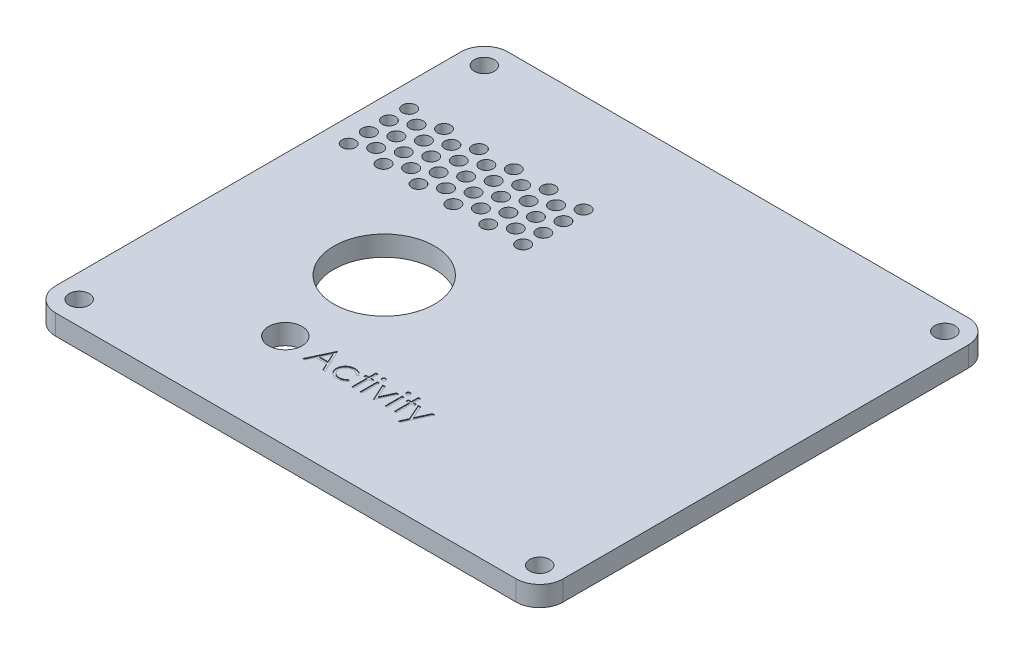
from build123d import *

# Parameters (mm, degrees)
ESQUISSE1_W                         = 75.58
ESQUISSE1_H                         = 67.34
ESQUISSE1_R                         = 1.5
BOSS_EXTRU_1_DEPTH                  = 3
ESQUISSE3_R                         = 2.5
ESQUISSE3_R_2                       = 7.5
ENL_V_MAT_EXTRU_1_DEPTH             = 52.83023249
ESQUISSE5_R                         = 1
ENL_V_MAT_EXTRU_3_DEPTH             = 52.83023249
R_P_TITION_DANS_UNE_ZONE2_OUTLINE_R = 1
R_P_TITION_DANS_UNE_ZONE2_DEPTH     = 3
CONG_1_R                            = 3.5
ESQUISSE6_W                         = 0.314102564
ESQUISSE6_H                         = 2.557692308
ESQUISSE6_W_2                       = 0.314102565
ENL_V_MAT_EXTRU_4_DEPTH             = 0.1


# Read off the part's stored shape, not the designer's step: Répétition dans une zone2
with BuildPart() as part:
    # Esquisse1 → Boss.-Extru.1 (new body)
    with BuildSketch(Plane(origin=(0, 0, 0), x_dir=(1, 0, 0), z_dir=(0, 1, 0))):
        with Locations((1.5, 0)):
            Rectangle(ESQUISSE1_W, ESQUISSE1_H)
        with Locations(Location((-32.79, 30.17, 0), (0, 0, 270))):
            Circle(ESQUISSE1_R, mode=Mode.SUBTRACT)
        with Locations(Location((35.79, 30.17, 0), (0, 0, 270))):
            Circle(ESQUISSE1_R, mode=Mode.SUBTRACT)
        with Locations(Location((35.79, -30.17, 0), (0, 0, 270))):
            Circle(ESQUISSE1_R, mode=Mode.SUBTRACT)
        with Locations(Location((-32.79, -30.17, 0), (0, 0, 270))):
            Circle(ESQUISSE1_R, mode=Mode.SUBTRACT)
    extrude(amount=BOSS_EXTRU_1_DEPTH)

    # Esquisse3 → Enlèv. mat.-Extru.1 (cut, through all)
    with BuildSketch(Plane(origin=(0, 3, 0), x_dir=(1, 0, 0), z_dir=(0, 1, 0))):
        with Locations(Location((-12.7, -19.558, 0), (0, 0, 270))):
            Circle(ESQUISSE3_R)
        with Locations(Location((-13.208, -4.318, 0), (0, 0, 270))):
            Circle(ESQUISSE3_R_2)
    extrude(amount=-ENL_V_MAT_EXTRU_1_DEPTH, mode=Mode.SUBTRACT)

    # Esquisse5 → Enlèv. mat.-Extru.3 (cut, through all)
    with BuildSketch(Plane(origin=(0, 3, 0), x_dir=(1, 0, 0), z_dir=(0, 1, 0))):
        with Locations(Location((-19.81, 14.48, 0), (0, 0, 270))):
            Circle(ESQUISSE5_R)
    extrude(amount=-ENL_V_MAT_EXTRU_3_DEPTH, mode=Mode.SUBTRACT)

    # Répétition dans une zone2 outline → Répétition dans une zone2 (cut)
    with BuildSketch(Plane(origin=(0, 0, 0), x_dir=(1, 0, 0), z_dir=(0, 1, 0))):
        with Locations((-6.819618943, 18.98)):
            Circle(R_P_TITION_DANS_UNE_ZONE2_OUTLINE_R)
        with Locations((-27.604228634, 9.98)):
            Circle(R_P_TITION_DANS_UNE_ZONE2_OUTLINE_R)
        with Locations((-30.202304845, 11.48)):
            Circle(R_P_TITION_DANS_UNE_ZONE2_OUTLINE_R)
        with Locations((-32.800381057, 12.98)):
            Circle(R_P_TITION_DANS_UNE_ZONE2_OUTLINE_R)
        with Locations((-22.408076211, 9.98)):
            Circle(R_P_TITION_DANS_UNE_ZONE2_OUTLINE_R)
        with Locations((-32.800381057, 9.98)):
            Circle(R_P_TITION_DANS_UNE_ZONE2_OUTLINE_R)
        with Locations((-22.408076211, 18.98)):
            Circle(R_P_TITION_DANS_UNE_ZONE2_OUTLINE_R)
        with Locations((-19.81, 17.48)):
            Circle(R_P_TITION_DANS_UNE_ZONE2_OUTLINE_R)
        with Locations((-17.211923789, 15.98)):
            Circle(R_P_TITION_DANS_UNE_ZONE2_OUTLINE_R)
        with Locations((-14.613847577, 14.48)):
            Circle(R_P_TITION_DANS_UNE_ZONE2_OUTLINE_R)
        with Locations((-27.604228634, 18.98)):
            Circle(R_P_TITION_DANS_UNE_ZONE2_OUTLINE_R)
        with Locations((-6.819618943, 9.98)):
            Circle(R_P_TITION_DANS_UNE_ZONE2_OUTLINE_R)
        with Locations((-9.417695155, 11.48)):
            Circle(R_P_TITION_DANS_UNE_ZONE2_OUTLINE_R)
        with Locations((-12.015771366, 12.98)):
            Circle(R_P_TITION_DANS_UNE_ZONE2_OUTLINE_R)
        with Locations((-17.211923789, 18.98)):
            Circle(R_P_TITION_DANS_UNE_ZONE2_OUTLINE_R)
        with Locations((-6.819618943, 15.98)):
            Circle(R_P_TITION_DANS_UNE_ZONE2_OUTLINE_R)
        with Locations((-9.417695155, 17.48)):
            Circle(R_P_TITION_DANS_UNE_ZONE2_OUTLINE_R)
        with Locations((-12.015771366, 18.98)):
            Circle(R_P_TITION_DANS_UNE_ZONE2_OUTLINE_R)
        with Locations((-14.613847577, 17.48)):
            Circle(R_P_TITION_DANS_UNE_ZONE2_OUTLINE_R)
        with Locations((-12.015771366, 15.98)):
            Circle(R_P_TITION_DANS_UNE_ZONE2_OUTLINE_R)
        with Locations((-9.417695155, 14.48)):
            Circle(R_P_TITION_DANS_UNE_ZONE2_OUTLINE_R)
        with Locations((-6.819618943, 12.98)):
            Circle(R_P_TITION_DANS_UNE_ZONE2_OUTLINE_R)
        with Locations((-25.006152423, 14.48)):
            Circle(R_P_TITION_DANS_UNE_ZONE2_OUTLINE_R)
        with Locations((-22.408076211, 12.98)):
            Circle(R_P_TITION_DANS_UNE_ZONE2_OUTLINE_R)
        with Locations((-19.81, 11.48)):
            Circle(R_P_TITION_DANS_UNE_ZONE2_OUTLINE_R)
        with Locations((-17.211923789, 9.98)):
            Circle(R_P_TITION_DANS_UNE_ZONE2_OUTLINE_R)
        with Locations((-32.800381057, 15.98)):
            Circle(R_P_TITION_DANS_UNE_ZONE2_OUTLINE_R)
        with Locations((-30.202304845, 14.48)):
            Circle(R_P_TITION_DANS_UNE_ZONE2_OUTLINE_R)
        with Locations((-27.604228634, 12.98)):
            Circle(R_P_TITION_DANS_UNE_ZONE2_OUTLINE_R)
        with Locations((-25.006152423, 11.48)):
            Circle(R_P_TITION_DANS_UNE_ZONE2_OUTLINE_R)
        with Locations((-25.006152423, 17.48)):
            Circle(R_P_TITION_DANS_UNE_ZONE2_OUTLINE_R)
        with Locations((-22.408076211, 15.98)):
            Circle(R_P_TITION_DANS_UNE_ZONE2_OUTLINE_R)
        with Locations((-17.211923789, 12.98)):
            Circle(R_P_TITION_DANS_UNE_ZONE2_OUTLINE_R)
        with Locations((-14.613847577, 11.48)):
            Circle(R_P_TITION_DANS_UNE_ZONE2_OUTLINE_R)
        with Locations((-27.604228634, 15.98)):
            Circle(R_P_TITION_DANS_UNE_ZONE2_OUTLINE_R)
        with Locations((-30.202304845, 17.48)):
            Circle(R_P_TITION_DANS_UNE_ZONE2_OUTLINE_R)
        with Locations((-32.800381057, 18.98)):
            Circle(R_P_TITION_DANS_UNE_ZONE2_OUTLINE_R)
        with Locations((-12.015771366, 9.98)):
            Circle(R_P_TITION_DANS_UNE_ZONE2_OUTLINE_R)
    extrude(amount=R_P_TITION_DANS_UNE_ZONE2_DEPTH, mode=Mode.SUBTRACT)

    # Congé1
    cong_1_edges = [part.edges().sort_by_distance(p)[0] for p in [
        (39.29, 1.5, 33.67),
        (-36.29, 1.5, 33.67),
        (-36.29, 1.5, -33.67),
        (39.29, 1.5, -33.67),
    ]]
    fillet(cong_1_edges, radius=CONG_1_R)

    # Esquisse6 → Enlèv. mat.-Extru.4 (cut)
    # profile 1 of 10: a face of its own
    with BuildSketch(Plane(origin=(0, 3, 0), x_dir=(1, 0, 0), z_dir=(0, 1, 0))):
        Polygon((-6.815384615, -17.658), (-5.2, -21.158), (-5.541446314, -21.158), (-6.058874199, -20.036205128), (-7.645512821, -20.036205128), (-8.177664263, -21.158), (-8.520512821, -21.158), (-6.86025641, -17.658), align=None)
        Polygon((-6.841326122, -18.340191506), (-7.475140224, -19.677230769), (-6.224338942, -19.677230769), align=None, mode=Mode.SUBTRACT)
    # profile 2 of 10: a face of its own
    with BuildSketch(Plane(origin=(0, 3, 0), x_dir=(1, 0, 0), z_dir=(0, 1, 0))):
        with BuildLine():
            Line((-2.148717949, -19.154895032), (-2.411638622, -19.31825641))
            add(Edge.make_bspline(
                [(-2.411638622, -19.31825641), (-2.440468487, -19.282428016), (-2.497215182, -19.211905906), (-2.595754419, -19.120895973), (-2.700765833, -19.042728931), (-2.814043881, -18.97902518), (-2.935429681, -18.92980373), (-3.064444532, -18.894973524), (-3.201070037, -18.873269281), (-3.294735236, -18.870802445), (-3.342728365, -18.869538462)],
                knots=[0, 0, 0, 0, 1.026593902, 2.0206758, 2.988051866, 3.946915611, 4.916868779, 5.907761954, 6.927957743, 8, 8, 8, 8], degree=3))
            add(Edge.make_bspline(
                [(-3.342728365, -18.869538462), (-3.381087322, -18.870595304), (-3.456634245, -18.872676726), (-3.567540398, -18.885687219), (-3.673182752, -18.909329227), (-3.77422346, -18.940480184), (-3.869943879, -18.982230474), (-3.960594797, -19.03304023), (-4.046980287, -19.09209027), (-4.126597029, -19.160500816), (-4.199426036, -19.234899484), (-4.26252495, -19.314653179), (-4.317461883, -19.39737307), (-4.360567839, -19.485124812), (-4.39584301, -19.575900866), (-4.41904973, -19.671414721), (-4.434514425, -19.770442729), (-4.436283754, -19.837961069), (-4.437179487, -19.872142628)],
                knots=[0, 0, 0, 0, 1.112346261, 2.190735716, 3.231507886, 4.247384806, 5.251966152, 6.253067467, 7.256802811, 8.280671706, 9.291813951, 10.270744147, 11.225547591, 12.165006084, 13.100104208, 14.043489273, 15.009504848, 16, 16, 16, 16], degree=3))
            add(Edge.make_bspline(
                [(-4.437179487, -19.872142628), (-4.435400235, -19.916911839), (-4.431865704, -20.005847035), (-4.404164245, -20.137125137), (-4.358819837, -20.264048827), (-4.296761987, -20.385716964), (-4.218284852, -20.49831112), (-4.126112289, -20.599294574), (-4.020193206, -20.686710602), (-3.901460875, -20.759183127), (-3.772703132, -20.817444495), (-3.635313027, -20.858951828), (-3.490413246, -20.8840042), (-3.391206499, -20.887160143), (-3.340625, -20.888769231)],
                knots=[0, 0, 0, 0, 0.966302908, 1.919585723, 2.883856336, 3.870342332, 4.860282998, 5.839159637, 6.814385684, 7.815993281, 8.834850808, 9.858348828, 10.908058873, 12, 12, 12, 12], degree=3))
            add(Edge.make_bspline(
                [(-3.340625, -20.888769231), (-3.294269816, -20.887469734), (-3.203169577, -20.884915877), (-3.070002292, -20.863386913), (-2.943222381, -20.82814328), (-2.822834351, -20.77899563), (-2.709058185, -20.715468114), (-2.60262901, -20.637108943), (-2.501429071, -20.546172343), (-2.441932095, -20.475854371), (-2.411638622, -20.440051282)],
                knots=[0, 0, 0, 0, 1.039848629, 2.043578496, 3.018386758, 3.987534228, 4.954977003, 5.934852016, 6.948509513, 8, 8, 8, 8], degree=3))
            Line((-2.411638622, -20.440051282), (-2.148717949, -20.612527244))
            add(Edge.make_bspline(
                [(-2.148717949, -20.612527244), (-2.164305651, -20.635417971), (-2.195429318, -20.681123447), (-2.247456943, -20.745567564), (-2.303576775, -20.805889246), (-2.363569872, -20.862007636), (-2.426652882, -20.915265655), (-2.494980791, -20.96311723), (-2.566350403, -21.008252053), (-2.64159956, -21.048864925), (-2.719950258, -21.085371246), (-2.801292248, -21.116762417), (-2.885272061, -21.143732523), (-2.971988437, -21.16516987), (-3.061612335, -21.182280708), (-3.15391197, -21.19363441), (-3.248855551, -21.202109691), (-3.313027703, -21.202615558), (-3.345532853, -21.202871795)],
                knots=[0, 0, 0, 0, 0.954134338, 1.905101784, 2.851144739, 3.791306361, 4.734911809, 5.6936923, 6.663572882, 7.643865596, 8.638447847, 9.640600242, 10.646758161, 11.676244097, 12.717260333, 13.78922464, 14.880174919, 16, 16, 16, 16], degree=3))
            add(Edge.make_bspline(
                [(-3.345532853, -21.202871795), (-3.395143736, -21.201980515), (-3.492381428, -21.2002336), (-3.634703936, -21.181025125), (-3.770717603, -21.152067509), (-3.900375961, -21.110503775), (-4.023699195, -21.056998999), (-4.140572314, -20.991642085), (-4.250608332, -20.913890295), (-4.352719115, -20.825127525), (-4.446500561, -20.728886885), (-4.527026751, -20.625036967), (-4.596872022, -20.517395919), (-4.652959565, -20.403586393), (-4.697606491, -20.28512102), (-4.728111324, -20.16105078), (-4.747841062, -20.032398526), (-4.750124441, -19.944665644), (-4.751282051, -19.9001875)],
                knots=[0, 0, 0, 0, 1.1129367, 2.181364009, 3.217532258, 4.231199276, 5.232079859, 6.230262199, 7.231623845, 8.250719726, 9.263571943, 10.242672461, 11.195837495, 12.138959767, 13.085126421, 14.0317438, 15.002148558, 16, 16, 16, 16], degree=3))
            add(Edge.make_bspline(
                [(-4.751282051, -19.9001875), (-4.750841035, -19.870009065), (-4.749963781, -19.809979178), (-4.739901854, -19.720884111), (-4.726903381, -19.632975566), (-4.704877644, -19.547367847), (-4.679437012, -19.462762557), (-4.64696148, -19.380179455), (-4.608866085, -19.299234783), (-4.565614138, -19.220137053), (-4.516925393, -19.144187513), (-4.463044159, -19.072433849), (-4.405999823, -19.004014083), (-4.343123711, -18.941290323), (-4.277084057, -18.881754131), (-4.206012482, -18.826996007), (-4.13031663, -18.776855016), (-4.051133307, -18.730404001), (-3.968508596, -18.689044566), (-3.882941926, -18.653411328), (-3.794948897, -18.622958752), (-3.704388752, -18.598849833), (-3.611862579, -18.578632409), (-3.516641241, -18.565914563), (-3.419089019, -18.55692829), (-3.353032996, -18.555937498), (-3.319591346, -18.555435897)],
                knots=[0, 0, 0, 0, 0.990994727, 1.971252077, 2.943264845, 3.907940874, 4.872158414, 5.844625996, 6.82015047, 7.809835459, 8.804511986, 9.781214284, 10.756496977, 11.728388426, 12.696359165, 13.676225489, 14.672885716, 15.677705647, 16.690706858, 17.706033469, 18.721040654, 19.747369689, 20.783475414, 21.830280724, 22.901553713, 24, 24, 24, 24], degree=3))
            add(Edge.make_bspline(
                [(-3.319591346, -18.555435897), (-3.277711238, -18.556357788), (-3.194160358, -18.558196963), (-3.070219652, -18.573675615), (-2.948104458, -18.597012031), (-2.829957354, -18.631584861), (-2.71721084, -18.673448517), (-2.61167539, -18.720461231), (-2.515835286, -18.775055835), (-2.427907697, -18.834775949), (-2.347728179, -18.902136855), (-2.274473687, -18.977943812), (-2.206642038, -19.061802291), (-2.168185326, -19.123608022), (-2.148717949, -19.154895032)],
                knots=[0, 0, 0, 0, 1.095225653, 2.184976855, 3.262915854, 4.344593502, 5.400796181, 6.407717688, 7.363229445, 8.282371371, 9.184954523, 10.097238608, 11.036792983, 12, 12, 12, 12], degree=3))
        make_face()
    # profile 3 of 10: a face of its own
    with BuildSketch(Plane(origin=(0, 3, 0), x_dir=(1, 0, 0), z_dir=(0, 1, 0))):
        Polygon((-1.206410256, -17.56825641), (-0.892307692, -17.56825641), (-0.892307692, -18.600307692), (-0.443589744, -18.600307692), (-0.443589744, -18.914410256), (-0.892307692, -18.914410256), (-0.892307692, -21.158), (-1.206410256, -21.158), (-1.206410256, -18.914410256), (-1.655128205, -18.914410256), (-1.655128205, -18.600307692), (-1.206410256, -18.600307692), align=None)
    # profile 4 of 10: a face of its own
    with BuildSketch(Plane(origin=(0, 3, 0), x_dir=(1, 0, 0), z_dir=(0, 1, 0))):
        with BuildLine():
            add(Edge.make_bspline(
                [(0.205649038, -17.523384615), (0.225140354, -17.524288768), (0.263308094, -17.526059272), (0.318501362, -17.541220749), (0.368758374, -17.566920434), (0.413336107, -17.601400115), (0.451587993, -17.641949559), (0.478368704, -17.689210527), (0.4955811, -17.740269166), (0.497659655, -17.775884255), (0.498717949, -17.794017628)],
                knots=[0, 0, 0, 0, 1.055194115, 2.066272739, 3.074728998, 4.095836921, 5.109056067, 6.073838105, 7.019297344, 8, 8, 8, 8], degree=3))
            add(Edge.make_bspline(
                [(0.498717949, -17.794017628), (0.497635789, -17.811680281), (0.495496487, -17.846597256), (0.478381999, -17.896770728), (0.451359761, -17.943375012), (0.413360635, -17.983845722), (0.368751874, -18.018306342), (0.318503088, -18.044011081), (0.26330764, -18.059171218), (0.225140201, -18.060941907), (0.205649038, -18.061846154)],
                knots=[0, 0, 0, 0, 0.96129708, 1.900370562, 2.859976407, 3.87933698, 4.906634145, 5.921202961, 6.938410037, 8, 8, 8, 8], degree=3))
            add(Edge.make_bspline(
                [(0.205649038, -18.061846154), (0.186380763, -18.060976434), (0.148877583, -18.059283637), (0.094510741, -18.043713619), (0.044682251, -18.018297546), (1.7579e-05, -17.984071361), (-0.037212614, -17.943126464), (-0.06431094, -17.89679917), (-0.081385902, -17.846590015), (-0.08353053, -17.811677849), (-0.084615385, -17.794017628)],
                knots=[0, 0, 0, 0, 1.054934014, 2.053291228, 3.073705704, 4.106921865, 5.123545215, 6.088680038, 7.033164197, 8, 8, 8, 8], degree=3))
            add(Edge.make_bspline(
                [(-0.084615385, -17.794017628), (-0.083554298, -17.775886779), (-0.081470257, -17.740276646), (-0.064298141, -17.689181613), (-0.037438333, -17.642200111), (4.2231e-05, -17.601174612), (0.044675691, -17.566929177), (0.094512436, -17.541518196), (0.148877135, -17.525946856), (0.186380611, -17.524254242), (0.205649038, -17.523384615)],
                knots=[0, 0, 0, 0, 0.98631895, 1.937192651, 2.907499808, 3.917963147, 4.944918757, 5.95915025, 6.951458133, 8, 8, 8, 8], degree=3))
        make_face()
    # profile 5 of 10: a face of its own
    with BuildSketch(Plane(origin=(0, 3, 0), x_dir=(1, 0, 0), z_dir=(0, 1, 0))):
        with Locations((0.207051282, -19.879153846)):
            Rectangle(ESQUISSE6_W, ESQUISSE6_H)
    # profile 6 of 10: a face of its own
    with BuildSketch(Plane(origin=(0, 3, 0), x_dir=(1, 0, 0), z_dir=(0, 1, 0))):
        Polygon((0.857692308, -18.600307692), (1.197736378, -18.600307692), (2.046794872, -20.462487179), (2.895853365, -18.600307692), (3.235897436, -18.600307692), (2.069230769, -21.158), (2.024358974, -21.158), align=None)
    # profile 7 of 10: a face of its own
    with BuildSketch(Plane(origin=(0, 3, 0), x_dir=(1, 0, 0), z_dir=(0, 1, 0))):
        with BuildLine():
            add(Edge.make_bspline(
                [(3.885136218, -17.523384615), (3.904627534, -17.524288768), (3.942795274, -17.526059272), (3.997988541, -17.541220749), (4.048245553, -17.566920434), (4.092823286, -17.601400115), (4.131075173, -17.641949559), (4.157855883, -17.689210527), (4.175068279, -17.740269166), (4.177146835, -17.775884255), (4.178205128, -17.794017628)],
                knots=[0, 0, 0, 0, 1.055194115, 2.066272739, 3.074728998, 4.095836921, 5.109056067, 6.073838105, 7.019297344, 8, 8, 8, 8], degree=3))
            add(Edge.make_bspline(
                [(4.178205128, -17.794017628), (4.177122968, -17.811680281), (4.174983666, -17.846597256), (4.157869178, -17.896770728), (4.13084694, -17.943375012), (4.092847815, -17.983845722), (4.048239054, -18.018306342), (3.997990268, -18.044011081), (3.942794819, -18.059171218), (3.90462738, -18.060941907), (3.885136218, -18.061846154)],
                knots=[0, 0, 0, 0, 0.96129708, 1.900370562, 2.859976407, 3.87933698, 4.906634145, 5.921202961, 6.938410037, 8, 8, 8, 8], degree=3))
            add(Edge.make_bspline(
                [(3.885136218, -18.061846154), (3.865867943, -18.060976434), (3.828364763, -18.059283637), (3.77399792, -18.043713619), (3.724169431, -18.018297546), (3.679504758, -17.984071361), (3.642274565, -17.943126464), (3.61517624, -17.89679917), (3.598101278, -17.846590015), (3.595956649, -17.811677849), (3.594871795, -17.794017628)],
                knots=[0, 0, 0, 0, 1.054934014, 2.053291228, 3.073705704, 4.106921865, 5.123545215, 6.088680038, 7.033164197, 8, 8, 8, 8], degree=3))
            add(Edge.make_bspline(
                [(3.594871795, -17.794017628), (3.595932881, -17.775886779), (3.598016923, -17.740276646), (3.615189039, -17.689181613), (3.642048846, -17.642200111), (3.67952941, -17.601174612), (3.72416287, -17.566929177), (3.773999615, -17.541518196), (3.828364315, -17.525946856), (3.865867791, -17.524254242), (3.885136218, -17.523384615)],
                knots=[0, 0, 0, 0, 0.98631895, 1.937192651, 2.907499808, 3.917963147, 4.944918757, 5.95915025, 6.951458133, 8, 8, 8, 8], degree=3))
        make_face()
    # profile 8 of 10: a face of its own
    with BuildSketch(Plane(origin=(0, 3, 0), x_dir=(1, 0, 0), z_dir=(0, 1, 0))):
        with Locations((3.886538462, -19.879153846)):
            Rectangle(ESQUISSE6_W_2, ESQUISSE6_H)
    # profile 9 of 10: a face of its own
    with BuildSketch(Plane(origin=(0, 3, 0), x_dir=(1, 0, 0), z_dir=(0, 1, 0))):
        Polygon((5.120512821, -17.56825641), (5.434615385, -17.56825641), (5.434615385, -18.600307692), (5.883333333, -18.600307692), (5.883333333, -18.914410256), (5.434615385, -18.914410256), (5.434615385, -21.158), (5.120512821, -21.158), (5.120512821, -18.914410256), (4.671794872, -18.914410256), (4.671794872, -18.600307692), (5.120512821, -18.600307692), align=None)
    # profile 10 of 10: a face of its own
    with BuildSketch(Plane(origin=(0, 3, 0), x_dir=(1, 0, 0), z_dir=(0, 1, 0))):
        Polygon((6.152564103, -18.600307692), (6.491205929, -18.600307692), (7.357091346, -20.559241987), (8.236298077, -18.600307692), (8.575641026, -18.600307692), (7.005128205, -22.100307692), (6.665785256, -22.100307692), (7.18671875, -20.939951122), align=None)
    extrude(amount=-ENL_V_MAT_EXTRU_4_DEPTH, mode=Mode.SUBTRACT)


solid = part.part
